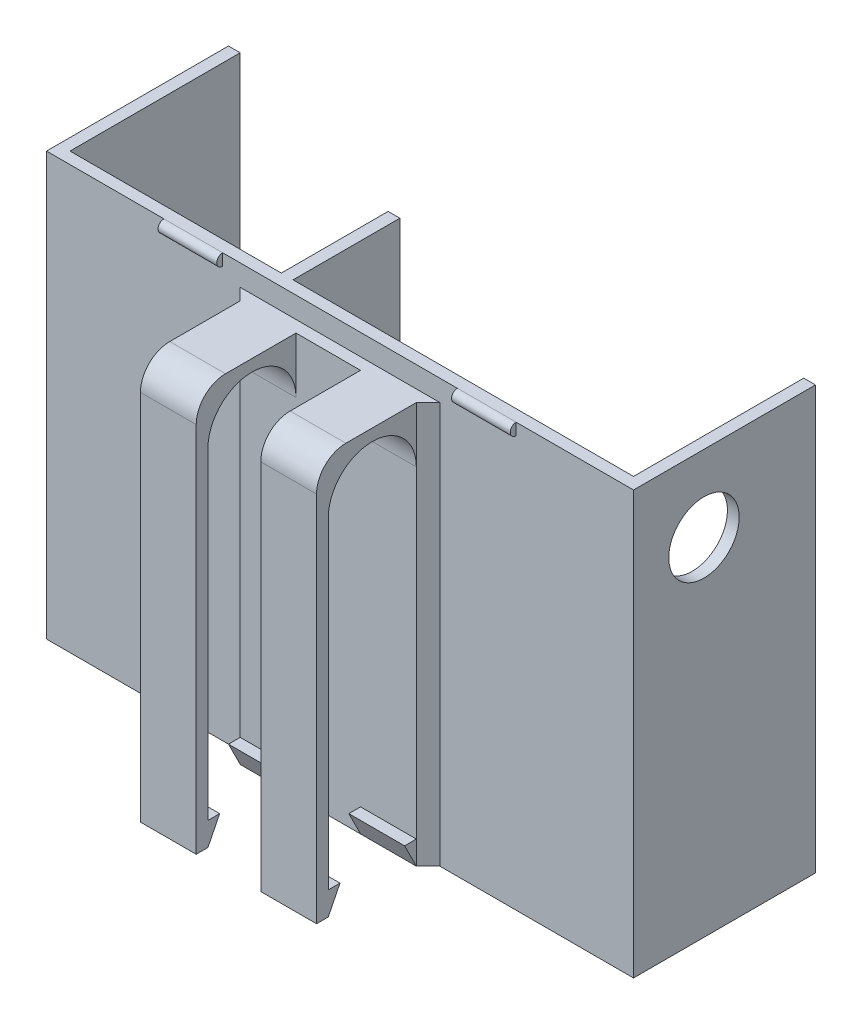
from build123d import *

# Parameters (mm, degrees)
BOSS_EXTRUDE1_DEPTH      = 30
FILLET1_R                = 5
SKETCH2_W                = 11
SKETCH2_H                = 68.4
CUT_EXTRUDE1_DEPTH       = 17
BOSS_EXTRUDE3_DEPTH      = 2
BOSS_EXTRUDE4_DEPTH      = 31
SKETCH4_W                = 2
SKETCH4_H                = 70
BOSS_EXTRUDE5_DEPTH      = 18.2
BOSS_EXTRUDE6_DEPTH      = 10
BOSS_EXTRUDE6_DEPTH_BACK = 10
BOSS_EXTRUDE7_START      = 20
BOSS_EXTRUDE7_DEPTH      = 10
BOSS_EXTRUDE8_START      = -30
BOSS_EXTRUDE8_DEPTH      = 10
CHAMFER1_SIZE            = 2
CUT_EXTRUDE2_REACH       = 134.242
SKETCH6_R                = 6


with BuildPart() as part:
    # Sketch1 → Boss-Extrude1 (new body)
    with BuildSketch(Plane(origin=(0, 0, 0), x_dir=(0, 0, -1), z_dir=(1, 0, 0))):
        with BuildLine():
            ThreePointArc((-2, 58.9), (7.5, 68.4), (17, 58.9))
            Line((17, 58.9), (17, 0))
            Line((17, 0), (15, 0))
            Line((15, 0), (15, 58.9))
            ThreePointArc((15, 58.9), (7.5, 66.4), (0, 58.9))
            Line((0, 58.9), (0, 0))
            Line((0, 0), (-2, 0))
            Line((-2, 0), (-2, 58.9))
        make_face()
        with BuildLine():
            Line((-2, 0), (0, 0))
            Line((0, 0), (0, 4))
            Line((0, 4), (0, 58.9))
            ThreePointArc((0, 58.9), (2.196699141, 64.203300859), (7.5, 66.4))
            Line((7.5, 66.4), (7.5, 68.4))
            ThreePointArc((7.5, 68.4), (0.782485579, 65.617514421), (-2, 58.9))
            Line((-2, 58.9), (-2, 0))
        make_face()
        Polygon((0, 4), (0, 0), (2, 4), align=None)
        Polygon((15, 0), (15, 4), (13, 4), align=None)
        with BuildLine():
            Line((17, 68.4), (7.5, 68.4))
            ThreePointArc((7.5, 68.4), (14.217514421, 65.617514421), (17, 58.9))
            Line((17, 58.9), (17, 68.4))
        make_face()
        with BuildLine():
            Line((-2, 68.4), (-2, 58.9))
            ThreePointArc((-2, 58.9), (0.782485579, 65.617514421), (7.5, 68.4))
            Line((7.5, 68.4), (-2, 68.4))
        make_face()
    extrude(amount=-BOSS_EXTRUDE1_DEPTH)

    # Fillet1
    fillet1_edges = [part.edges().sort_by_distance(p)[0] for p in [
        (-15, 68.4, 2),
    ]]
    fillet(fillet1_edges, radius=FILLET1_R)

    # Sketch2 → Cut-Extrude1 (cut)
    with BuildSketch(Plane.XY.offset(2)):
        with Locations((-15, 34.2)):
            Rectangle(SKETCH2_W, SKETCH2_H)
    extrude(amount=-CUT_EXTRUDE1_DEPTH, mode=Mode.SUBTRACT)

    # Sketch3 → Boss-Extrude3 (add)
    with BuildSketch(Plane(origin=(0, 0, -17), x_dir=(-1, 0, 0), z_dir=(0, 0, -1))):
        Polygon((-33, 2), (0, 2), (0, 0), (65, 0), (65, 72), (-33, 72), align=None)
    extrude(amount=BOSS_EXTRUDE3_DEPTH)

    # Sketch3<3> → Boss-Extrude4 (add)
    with BuildSketch(Plane(origin=(0, 0, -17), x_dir=(-1, 0, 0), z_dir=(0, 0, -1))):
        Polygon((65, 72), (63, 72), (63, 2), (-33, 2), (-33, 72), (-35, 72), (-35, 0), (65, 0), align=None)
    extrude(amount=BOSS_EXTRUDE4_DEPTH)

    # Sketch4 → Boss-Extrude5 (add)
    with BuildSketch(Plane(origin=(0, 0, -19), x_dir=(-1, 0, 0), z_dir=(0, 0, -1))):
        with Locations((26, 37)):
            Rectangle(SKETCH4_W, SKETCH4_H)
    extrude(amount=BOSS_EXTRUDE5_DEPTH)

    # Sketch5 → Boss-Extrude6 (add, two sides: drawn at the far end of the back side and taken through both)
    with BuildSketch(Plane.ZY.offset(15).offset(-BOSS_EXTRUDE6_DEPTH_BACK)):
        with BuildLine():
            Line((-47.8, 0), (-45.8, 0))
            ThreePointArc((-45.8, 0), (-46.8, -1), (-47.8, 0))
        make_face()
    extrude(amount=BOSS_EXTRUDE6_DEPTH + BOSS_EXTRUDE6_DEPTH_BACK)

    # Sketch5<3> → Boss-Extrude7 (add)
    with BuildSketch(Plane.ZY.offset(15).offset(BOSS_EXTRUDE7_START)):
        with BuildLine():
            ThreePointArc((-17, 72), (-16, 71), (-17, 70))
            Line((-17, 70), (-17, 72))
        make_face()
    extrude(amount=BOSS_EXTRUDE7_DEPTH)

    # Sketch5<4> → Boss-Extrude8 (add)
    with BuildSketch(Plane.ZY.offset(15).offset(BOSS_EXTRUDE8_START)):
        with BuildLine():
            ThreePointArc((-17, 72), (-16, 71), (-17, 70))
            Line((-17, 70), (-17, 72))
        make_face()
    extrude(amount=BOSS_EXTRUDE8_DEPTH)

    # Chamfer1
    chamfer1_edges = [part.edges().sort_by_distance(p)[0] for p in [
        (-30, 34.2, -17),
        (0, 34.2, -17),
    ]]
    chamfer(chamfer1_edges, length=CHAMFER1_SIZE - 0.0001)  # a hair under: the kernel refuses the full size

    # Sketch6 → Cut-Extrude2 (cut, up to next)
    with BuildSketch(Plane(origin=(35, 0, 0), x_dir=(0, 0, -1), z_dir=(1, 0, 0)), mode=Mode.PRIVATE) as cut_extrude2_sk1:
        with Locations(Location((29, 59, 0), (0, 0, 90))):
            Circle(SKETCH6_R)
    cut_extrude2_tool1 = extrude(cut_extrude2_sk1.sketch, amount=-CUT_EXTRUDE2_REACH, mode=Mode.PRIVATE) & part.part
    add(cut_extrude2_tool1.solids().sort_by_distance((35, 59, -29))[0], mode=Mode.SUBTRACT)


solid = part.part
